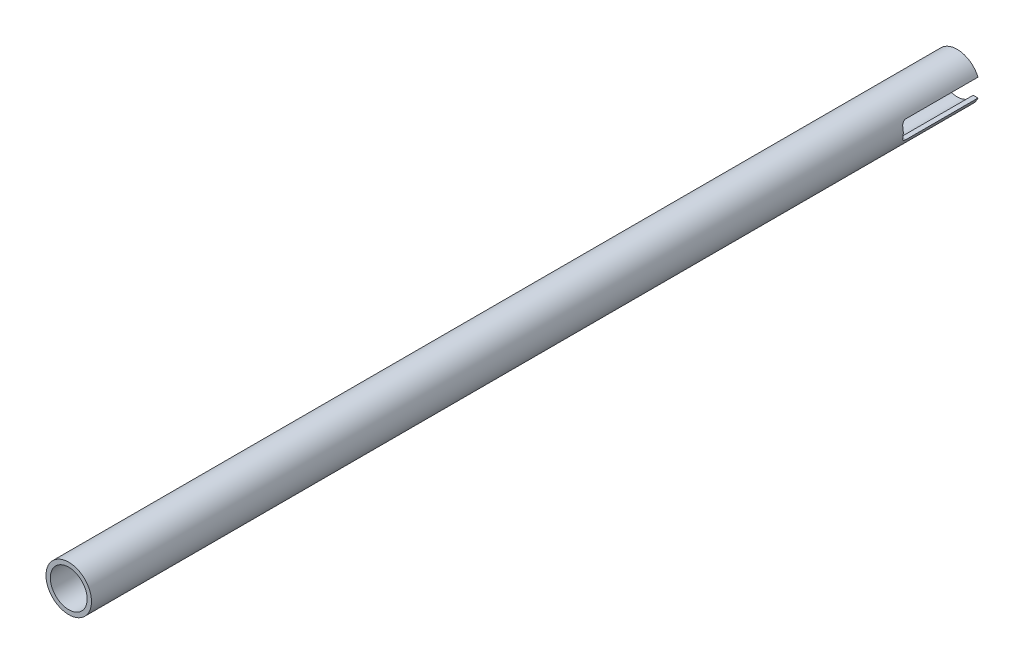
from build123d import *

# Parameters (mm, degrees)
SKETCH1_R               = 8.001
SKETCH1_R_2             = 6.477
BOSS_EXTRUDE1_DEPTH     = 312.42
CUT_EXTRUDE2_DEPTH      = 313.624836509
CUT_EXTRUDE2_DEPTH_BACK = 313.624836509


with BuildPart() as part:
    # Sketch1 → Boss-Extrude1 (new body)
    with BuildSketch(Plane.XY):
        Circle(SKETCH1_R)
        Circle(SKETCH1_R_2, mode=Mode.SUBTRACT)
    extrude(amount=BOSS_EXTRUDE1_DEPTH)

    # Sketch2 → Cut-Extrude2 (cut, two sides: drawn at the far end of the back side and taken through both)
    with BuildSketch(Plane(origin=(0, 0, 0), x_dir=(0, 0, -1), z_dir=(1, 0, 0)).offset(-CUT_EXTRUDE2_DEPTH_BACK)):
        with BuildLine():
            Line((635.239664052, 3.175), (0, 3.175))
            Line((0, 3.175), (-25.4, 3.175))
            ThreePointArc((-25.4, 3.175), (-26.477630735, 2.728630735), (-26.924, 1.651))
            Line((-26.924, 1.651), (-26.924, -1.651))
            ThreePointArc((-26.924, -1.651), (-26.477630735, -2.728630735), (-25.4, -3.175))
            Line((-25.4, -3.175), (0, -3.175))
            Line((0, -3.175), (635.239664052, -3.175))
            Line((635.239664052, -3.175), (1905.718992156, -3.175))
            Line((1905.718992156, -3.175), (1905.718992156, 3.175))
            Line((1905.718992156, 3.175), (635.239664052, 3.175))
        make_face()
    extrude(amount=CUT_EXTRUDE2_DEPTH + CUT_EXTRUDE2_DEPTH_BACK, mode=Mode.SUBTRACT)


solid = part.part
